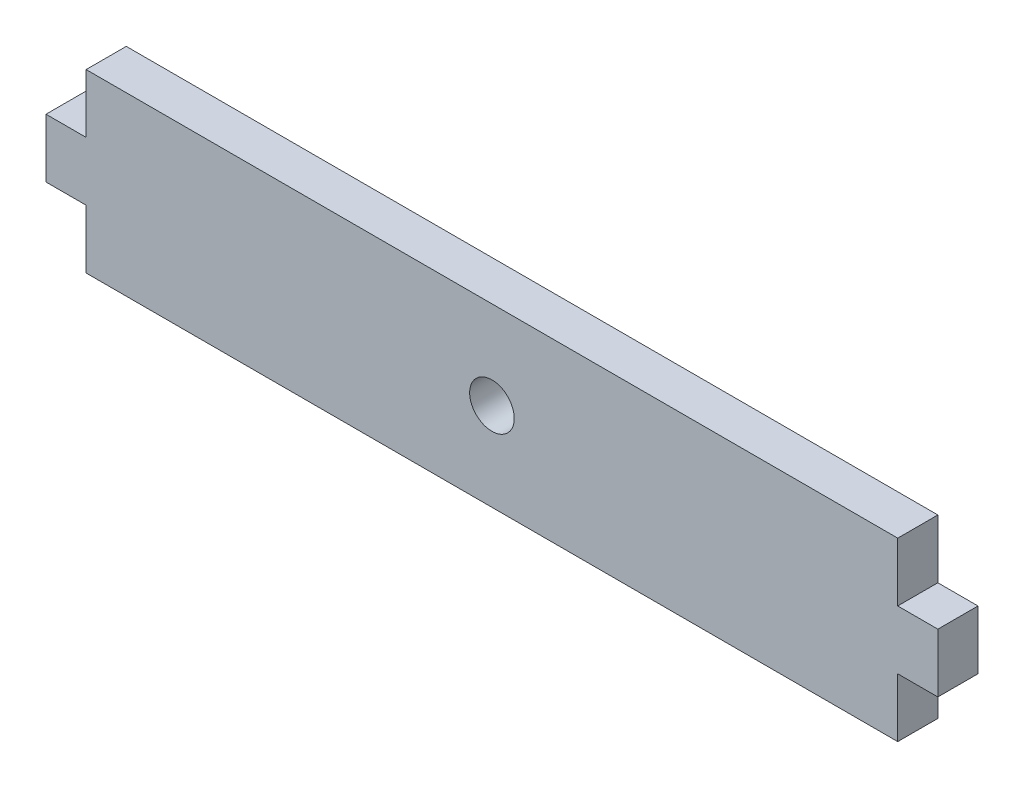
from build123d import *

# Parameters (mm, degrees)
SKETCH1_R           = 2.5
BOSS_EXTRUDE1_DEPTH = 4.5


with BuildPart() as part:
    # Sketch1 → Boss-Extrude1 (new body)
    with BuildSketch(Plane.XY):
        Polygon((4.5, -1.162405209), (95.5, -1.162405209), (95.5, 5.424557644), (100, 5.424557644), (100, 12.011520496), (95.5, 12.011520496), (95.5, 18.598483349), (4.5, 18.598483349), (4.5, 12.011520496), (0, 12.011520496), (0, 5.424557644), (4.5, 5.424557644), align=None)
        with Locations((50, 8.71803907)):
            Circle(SKETCH1_R, mode=Mode.SUBTRACT)
    extrude(amount=BOSS_EXTRUDE1_DEPTH)


solid = part.part
